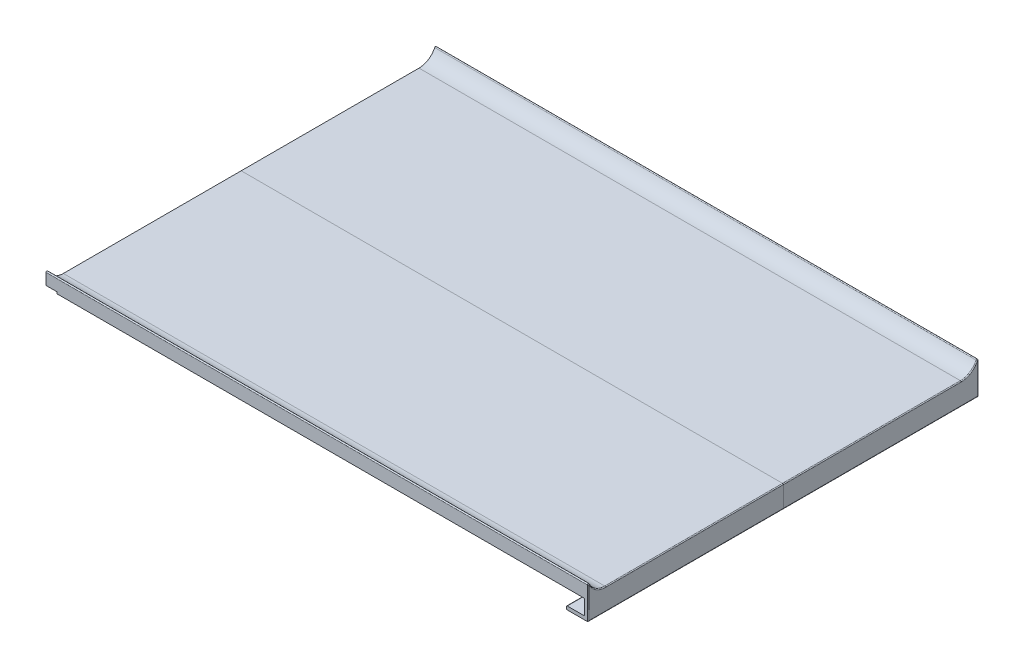
from build123d import *

# Parameters (mm, degrees)
SKETCH1_W           = 250
SKETCH1_H           = 1.6
BOSS_EXTRUDE1_DEPTH = 90
BOSS_EXTRUDE2_DEPTH = 180
SKETCH3_W           = 5
SKETCH3_H           = 0.8
CUT_EXTRUDE1_DEPTH  = 309.178454795
BOSS_EXTRUDE3_DEPTH = 250
FILLET2_R           = 0.4
MIRROR1_DEPTH       = 250
FILLET1_R           = 0.4


# Read off the part's stored shape, not the designer's step: Mirror1
with BuildPart() as part:
    # Sketch1 → Boss-Extrude1 (new, symmetric)
    with BuildSketch(Plane.XY):
        with Locations((125, 0.8)):
            Rectangle(SKETCH1_W, SKETCH1_H)
    extrude(amount=BOSS_EXTRUDE1_DEPTH, both=True)

    # Sketch2 → Boss-Extrude2 (add)
    with BuildSketch(Plane.XY.offset(90)):
        Polygon((250, 0), (248.4, 0), (248.4, -7), (240, -7), (240, -8.6), (250, -8.6), align=None)
    extrude(amount=-BOSS_EXTRUDE2_DEPTH)

    # Sketch3 → Cut-Extrude1 (cut, through all)
    with BuildSketch(Plane.XY.offset(90)):
        with Locations((2.5, 0.4)):
            Rectangle(SKETCH3_W, SKETCH3_H)
    extrude(amount=-CUT_EXTRUDE1_DEPTH, mode=Mode.SUBTRACT)

    # Sketch6 → Boss-Extrude3 (add)
    with BuildSketch(Plane(origin=(250, 0, 0), x_dir=(0, 0, -1), z_dir=(1, 0, 0))):
        with BuildLine():
            Line((-90, 1.6), (-82, 1.6))
            ThreePointArc((-82, 1.6), (-87.656854249, 3.943145751), (-90, 9.6))
            Line((-90, 9.6), (-90, 1.6))
        make_face()
    extrude(amount=-BOSS_EXTRUDE3_DEPTH)

    # Fillet2
    fillet2_edges = [part.edges().sort_by_distance(p)[0] for p in [
        (125, 9.6, 90),
    ]]
    fillet(fillet2_edges, radius=FILLET2_R)

    # Mirror1 outline → Mirror1 (add)
    with BuildSketch(Plane.YZ):
        with BuildLine():
            Line((1.6, -82), (1.6, -90))
            Line((1.6, -90), (6.022291236, -90))
            ThreePointArc((6.022291236, -90), (6.412651265, -89.687287156), (6.19265832, -89.238095238))
            ThreePointArc((6.19265832, -89.238095238), (2.845048726, -86.286097675), (1.6, -82))
        make_face()
    extrude(amount=MIRROR1_DEPTH)

    # Fillet1
    fillet1_edges = [part.edges().sort_by_distance(p)[0] for p in [
        (250, -1.288854382, 90),
        (248.4, 0, 0),
        (248.4, -7, 0),
        (240, -7, 0),
        (240, -8.6, 0),
        (250, -8.6, 0),
        (0, 0.8, 0),
        (5, 0, 0),
        (250, 1.6, 0),
        (250, 2.845048726, 86.286097675),
        (250, -1.288854382, -90),
        (250, 6.412651265, 89.687287156),
        (250, 2.845048726, -86.286097675),
        (250, 6.412651265, -89.687287156),
    ]]
    fillet(fillet1_edges, radius=FILLET1_R - 0.0001)  # a hair under: the kernel refuses the full size


with BuildPart() as body_2:
    # Split1: the piece on the far side of the plane
    add(part.part)
    split(bisect_by=Plane.XY, keep=Keep.BOTTOM)


with BuildPart() as part_1:
    add(part.part)

    # Split1
    split(bisect_by=Plane.XY, keep=Keep.TOP)


solid = Compound([body_2.part, part_1.part])
